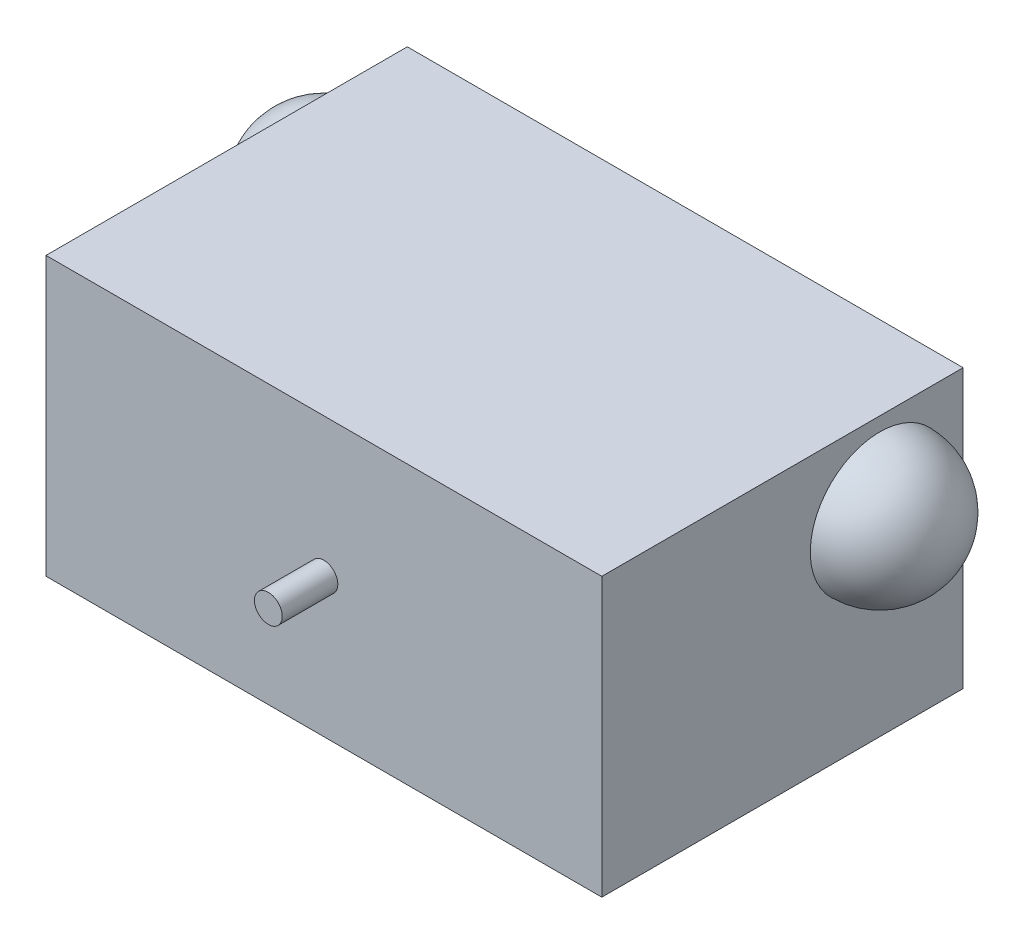
from build123d import *

# Parameters (mm, degrees)
BOSS_EXTRUDE1_DEPTH      = 50
BOSS_EXTRUDE1_DEPTH_BACK = 50
SKETCH2_W                = 200
SKETCH2_H                = 130
SKETCH4_R                = 5
BOSS_EXTRUDE2_DEPTH      = 20


with BuildPart() as part:
    # Sketch2 → Boss-Extrude1 (new, two sides: drawn at the far end of the back side and taken through both)
    with BuildSketch(Plane(origin=(0, 0, 0), x_dir=(1, 0, 0), z_dir=(0, 1, 0)).offset(-BOSS_EXTRUDE1_DEPTH_BACK)):
        Rectangle(SKETCH2_W, SKETCH2_H)
    extrude(amount=BOSS_EXTRUDE1_DEPTH + BOSS_EXTRUDE1_DEPTH_BACK)

    # Sketch4 → Boss-Extrude2 (add)
    with BuildSketch(Plane.XY.offset(65)):
        Circle(SKETCH4_R)
    extrude(amount=BOSS_EXTRUDE2_DEPTH)

    # Sketch6 → Revolve1 (revolve)
    with BuildSketch(Plane.ZY.offset(100)):
        with BuildLine():
            Line((-35, -5), (-35, 45))
            ThreePointArc((-35, 45), (-10, 20), (-35, -5))
        make_face()
    revolve1 = revolve(axis=Axis((-100, -5, -35), (0, 1, 0)))

    # Mirror1: Revolve1 across plane
    add(revolve1.mirror(Plane(origin=(0, 0, 0), x_dir=(0, 0, 1), z_dir=(1, 0, 0))))


solid = part.part
